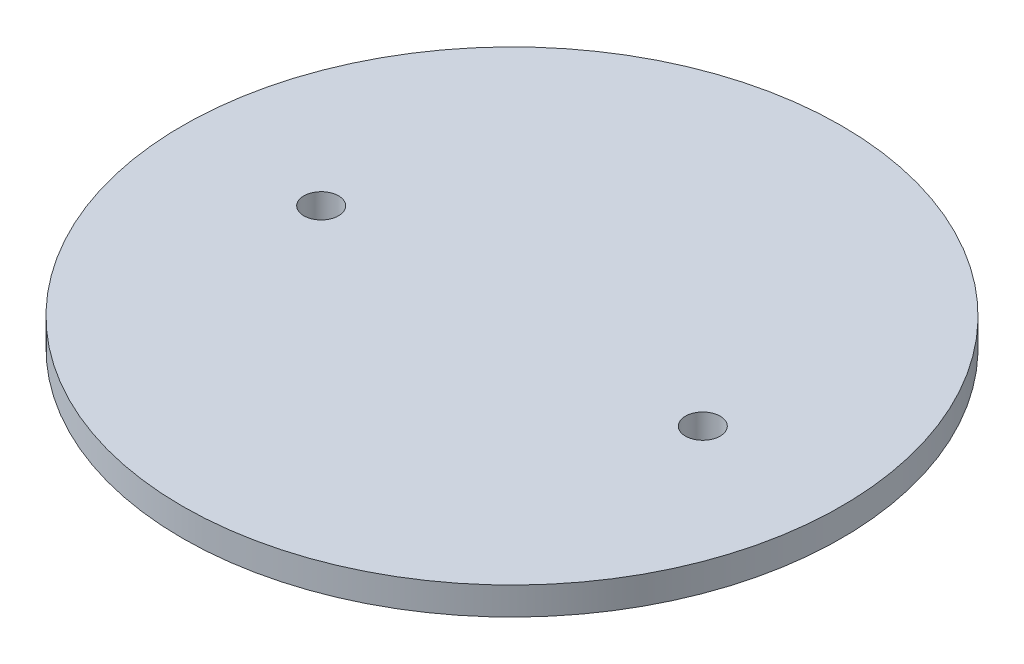
from build123d import *

# Parameters (mm, degrees)
SKETCH1_R           = 47.5
BOSS_EXTRUDE1_DEPTH = 4
SKETCH2_R           = 2.5
CUT_EXTRUDE1_DEPTH  = 68.294130502


with BuildPart() as part:
    # Sketch1 → Boss-Extrude1 (new body)
    with BuildSketch(Plane(origin=(0, 0, 0), x_dir=(1, 0, 0), z_dir=(0, 1, 0))):
        Circle(SKETCH1_R)
    extrude(amount=BOSS_EXTRUDE1_DEPTH)

    # Sketch2 → Cut-Extrude1 (cut, through all)
    with BuildSketch(Plane(origin=(0, 4, 0), x_dir=(1, 0, 0), z_dir=(0, 1, 0))):
        with Locations((-27.5, 0)):
            Circle(SKETCH2_R)
        with Locations((27.5, 0)):
            Circle(SKETCH2_R)
    extrude(amount=-CUT_EXTRUDE1_DEPTH, mode=Mode.SUBTRACT)


solid = part.part
